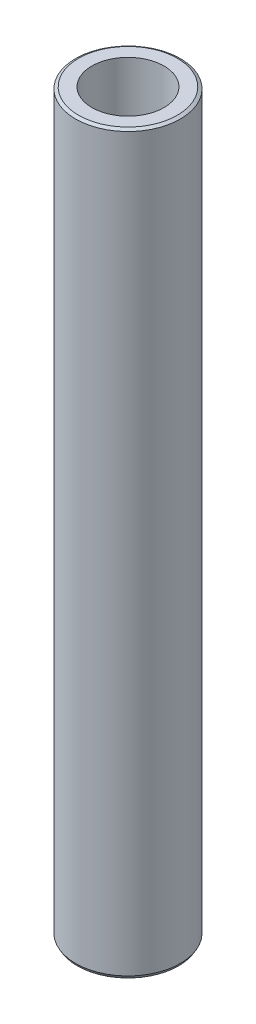
from build123d import *
from OCP.BRepFilletAPI import BRepFilletAPI_MakeChamfer

# Parameters (mm, degrees)
SKETCH1_R           = 32.5
BOSS_EXTRUDE1_DEPTH = 456.601619937
SKETCH2_R           = 22.370506082
CUT_EXTRUDE1_DEPTH  = 459.909075231
CHAMFER1_SIZE       = 1.077969959
CHAMFER1_SIZE2      = 1.867098738


with BuildPart() as part:
    # Sketch1 → Boss-Extrude1 (new body)
    with BuildSketch(Plane(origin=(0, 0, 0), x_dir=(1, 0, 0), z_dir=(0, 1, 0))):
        Circle(SKETCH1_R)
    extrude(amount=BOSS_EXTRUDE1_DEPTH)

    # Sketch2 → Cut-Extrude1 (cut, through all)
    with BuildSketch(Plane(origin=(0, 0, 0), x_dir=(1, 0, 0), z_dir=(0, 1, 0))):
        Circle(SKETCH2_R)
    extrude(amount=CUT_EXTRUDE1_DEPTH, mode=Mode.SUBTRACT)

    # Chamfer1: one chamfer whose edges measure the first distance from different faces: ONE call of the kernel's chamfer builder (chamfer() names one face for all edges)
    chamfer1_edges_1 = [part.edges().sort_by_distance(p)[0] for p in [
        (-32.5, 456.601619937, 0),
    ]]
    chamfer1_side_1 = [part.faces().sort_by_distance(p)[0] for p in [
        (-32.5, 228.300809969, 0),
    ]]
    chamfer1_edges_2 = [part.edges().sort_by_distance(p)[0] for p in [
        (-32.5, 0, 0),
    ]]
    chamfer1_side_2 = [part.faces().sort_by_distance(p)[0] for p in [
        (-31.580761184, 0, 0),
    ]]
    chamfer1 = BRepFilletAPI_MakeChamfer(part.part.solid().wrapped)
    for e in chamfer1_edges_1:
        chamfer1.Add(CHAMFER1_SIZE, CHAMFER1_SIZE2, e.wrapped, chamfer1_side_1[0].wrapped)  # the first distance lies on this face
    for e in chamfer1_edges_2:
        chamfer1.Add(CHAMFER1_SIZE, CHAMFER1_SIZE2, e.wrapped, chamfer1_side_2[0].wrapped)  # the first distance lies on this face
    add(Compound.cast(chamfer1.Shape()), mode=Mode.REPLACE)


solid = part.part
